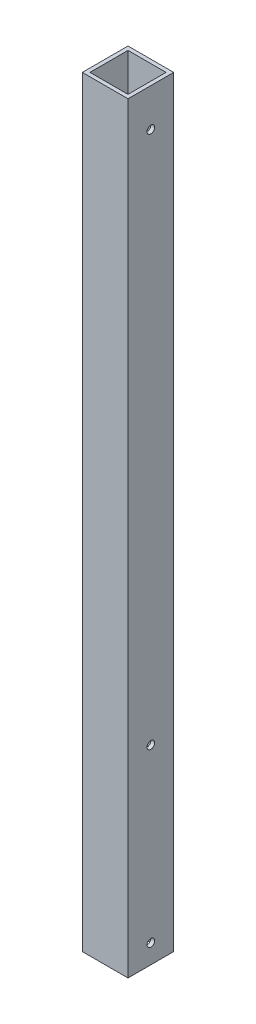
from build123d import *

# Parameters (mm, degrees)
SKETCH_1_W          = 12
SKETCH_1_H          = 12
SKETCH_1_W_2        = 8
SKETCH_1_H_2        = 8
EXTRUDE_1_DEPTH     = 200
SKETCH_2_R          = 1
CUT_EXTRUDE_1_DEPTH = 12
CUT_EXTRUDE_3_DEPTH = 200
SKETCH_6_R          = 1
CUT_EXTRUDE_4_DEPTH = 12
SKETCH_7_R          = 1
CUT_EXTRUDE_5_DEPTH = 12


with BuildPart() as part:
    # 草图1 → 凸台-拉伸1 (new body)
    with BuildSketch(Plane(origin=(0, 0, 0), x_dir=(1, 0, 0), z_dir=(0, 1, 0))):
        with Locations((6, 6)):
            Rectangle(SKETCH_1_W, SKETCH_1_H)
        with Locations((6, 6)):
            Rectangle(SKETCH_1_W_2, SKETCH_1_H_2, mode=Mode.SUBTRACT)
    extrude(amount=EXTRUDE_1_DEPTH)

    # 草图2 → 切除-拉伸1 (cut)
    with BuildSketch(Plane.ZY):
        with Locations((-6, 190)):
            Circle(SKETCH_2_R)
    extrude(amount=-CUT_EXTRUDE_1_DEPTH, mode=Mode.SUBTRACT)

    # 草图4 → 切除-拉伸3 (cut)
    with BuildSketch(Plane(origin=(0, 0, 0), x_dir=(-1, 0, 0), z_dir=(0, -1, 0))):
        Polygon((-11, 6), (-11, 1), (-1, 1), (-1, 11), (-11, 11), align=None)
    extrude(amount=-CUT_EXTRUDE_3_DEPTH, mode=Mode.SUBTRACT)

    # 草图6 → 切除-拉伸4 (cut)
    with BuildSketch(Plane(origin=(12, 0, 0), x_dir=(0, 0, -1), z_dir=(1, 0, 0))):
        with Locations((6, 5)):
            Circle(SKETCH_6_R)
    extrude(amount=-CUT_EXTRUDE_4_DEPTH, mode=Mode.SUBTRACT)

    # 草图7 → 切除-拉伸5 (cut)
    with BuildSketch(Plane.ZY):
        with Locations((-6, 50)):
            Circle(SKETCH_7_R)
    extrude(amount=-CUT_EXTRUDE_5_DEPTH, mode=Mode.SUBTRACT)


solid = part.part
